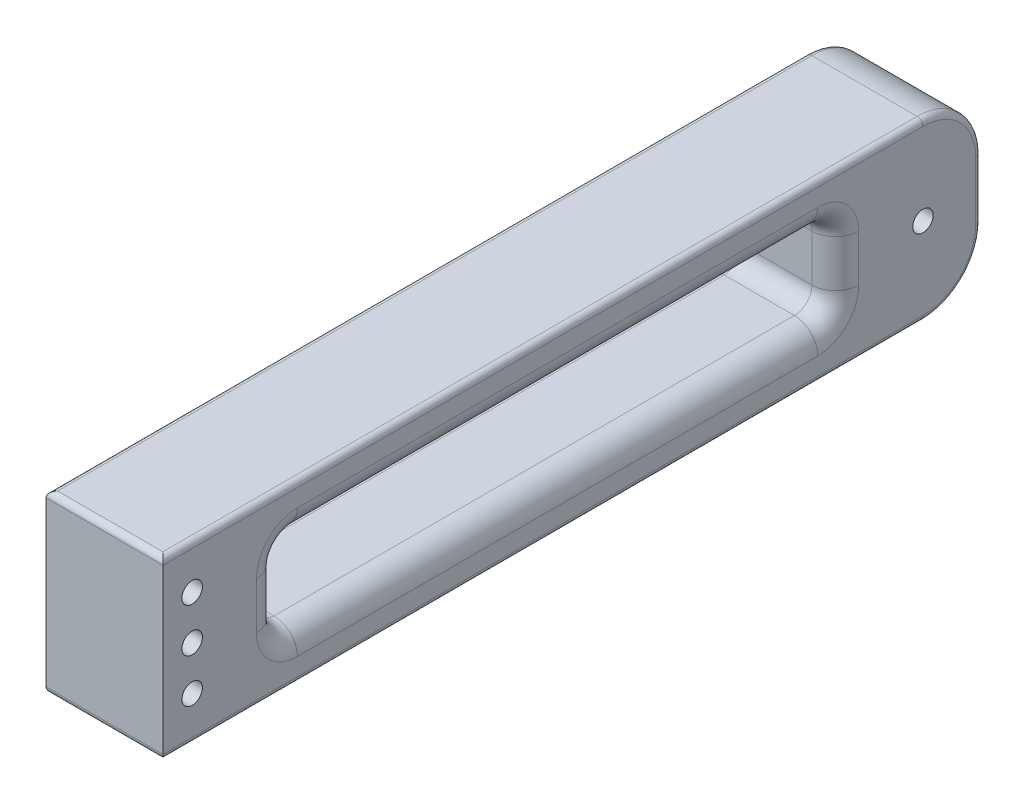
from build123d import *

# Parameters (mm, degrees)
SKETCH1_W           = 20
SKETCH1_H           = 30
BOSS_EXTRUDE1_DEPTH = 140
FILLET1_R           = 10
SKETCH2_R           = 1.75
CUT_EXTRUDE1_DEPTH  = 143.214626533
SKETCH3_R           = 4.75
CUT_EXTRUDE2_DEPTH  = 15
SKETCH4_R           = 1.75
CUT_EXTRUDE3_DEPTH  = 143.214626533
FILLET2_R           = 1
CUT_EXTRUDE4_DEPTH  = 143.214626533
FILLET3_R           = 4


with BuildPart() as part:
    # Sketch1 → Boss-Extrude1 (new body)
    with BuildSketch(Plane.XY):
        Rectangle(SKETCH1_W, SKETCH1_H)
    extrude(amount=BOSS_EXTRUDE1_DEPTH)

    # Fillet1
    fillet1_edges = [part.edges().sort_by_distance(p)[0] for p in [
        (0, -15, 0),
        (0, 15, 0),
    ]]
    fillet(fillet1_edges, radius=FILLET1_R)

    # Sketch2 → Cut-Extrude1 (cut, through all)
    with BuildSketch(Plane(origin=(10, 0, 0), x_dir=(0, 0, -1), z_dir=(1, 0, 0))):
        with Locations((-10, 0)):
            Circle(SKETCH2_R)
    extrude(amount=-CUT_EXTRUDE1_DEPTH, mode=Mode.SUBTRACT)

    # Sketch3 → Cut-Extrude2 (cut)
    with BuildSketch(Plane.ZY.offset(10)):
        with Locations((10, 0)):
            Circle(SKETCH3_R)
    extrude(amount=-CUT_EXTRUDE2_DEPTH, mode=Mode.SUBTRACT)

    # Sketch4 → Cut-Extrude3 (cut, through all)
    with BuildSketch(Plane(origin=(10, 0, 0), x_dir=(0, 0, -1), z_dir=(1, 0, 0))):
        with Locations((-135, 0)):
            Circle(SKETCH4_R)
        with Locations((-135, 7.5)):
            Circle(SKETCH4_R)
        with Locations((-135, -7.5)):
            Circle(SKETCH4_R)
    extrude(amount=-CUT_EXTRUDE3_DEPTH, mode=Mode.SUBTRACT)

    # Fillet2
    fillet2_edges = [part.edges().sort_by_distance(p)[0] for p in [
        (-10, -12.071067812, 2.928932188),
        (-10, 0, 0),
        (-10, 12.071067812, 2.928932188),
        (10, -12.071067812, 2.928932188),
        (10, 0, 0),
        (10, 12.071067812, 2.928932188),
        (-10, -15, 75),
        (10, -15, 75),
        (-10, 15, 75),
        (10, 15, 75),
        (0, -15, 140),
        (0, 15, 140),
    ]]
    fillet(fillet2_edges, radius=FILLET2_R)

    # Sketch5 → Cut-Extrude4 (cut, through all)
    with BuildSketch(Plane(origin=(10, 0, 0), x_dir=(0, 0, -1), z_dir=(1, 0, 0))):
        with BuildLine():
            Line((-117, 7), (-28, 7))
            ThreePointArc((-28, 7), (-25.878679656, 6.121320344), (-25, 4))
            Line((-25, 4), (-25, -4))
            ThreePointArc((-25, -4), (-25.878679656, -6.121320344), (-28, -7))
            Line((-28, -7), (-117, -7))
            ThreePointArc((-117, -7), (-119.121320344, -6.121320344), (-120, -4))
            Line((-120, -4), (-120, 4))
            ThreePointArc((-120, 4), (-119.121320344, 6.121320344), (-117, 7))
        make_face()
    extrude(amount=-CUT_EXTRUDE4_DEPTH, mode=Mode.SUBTRACT)

    # Fillet3
    fillet3_edges = [part.edges().sort_by_distance(p)[0] for p in [
        (10, 6.121320344, 25.878679656),
        (10, 0, 25),
        (10, -6.121320344, 25.878679656),
        (10, -7, 72.5),
        (10, -6.121320344, 119.121320344),
        (10, 0, 120),
        (10, 6.121320344, 119.121320344),
        (-10, 6.121320344, 25.878679656),
        (-10, 0, 25),
        (-10, -6.121320344, 25.878679656),
        (-10, -7, 72.5),
        (-10, -6.121320344, 119.121320344),
        (-10, 0, 120),
        (-10, 6.121320344, 119.121320344),
        (10, 7, 72.5),
        (-10, 7, 72.5),
    ]]
    fillet(fillet3_edges, radius=FILLET3_R)


solid = part.part
